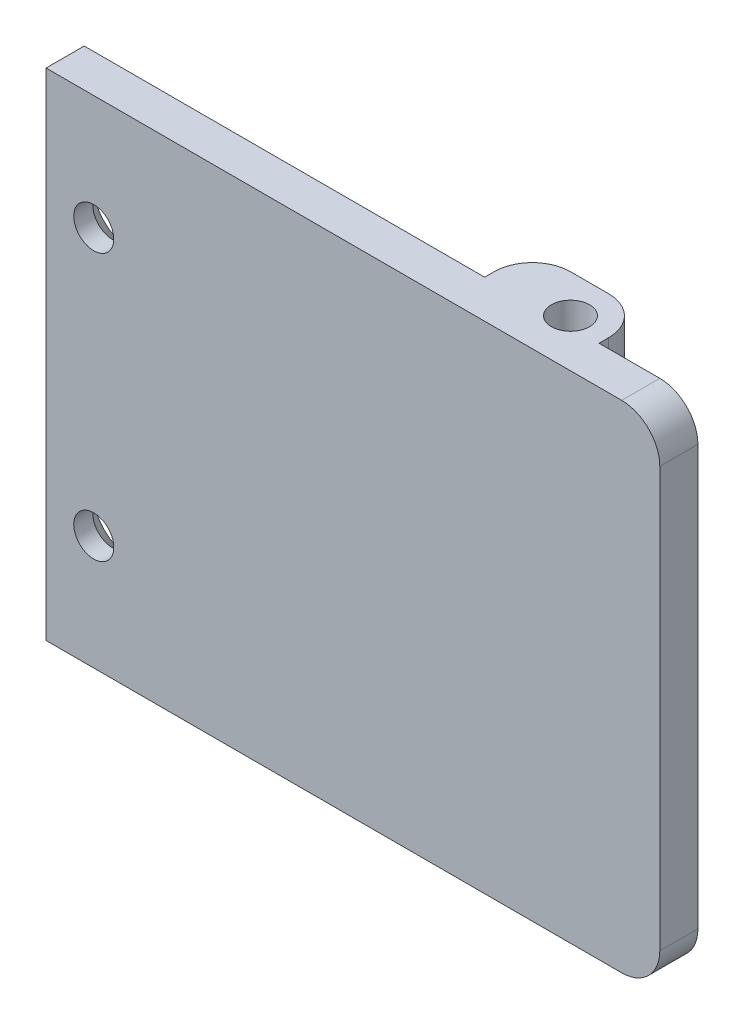
from build123d import *

# Parameters (mm, degrees)
SKETCH_2_W          = 32.183544672
SKETCH_2_H          = 26
EXTRUDE_1_DEPTH     = 2
FILLET_1_R          = 2
CUT_EXTRUDE_2_REACH = 38.671
SKETCH_4_R          = 1.05
CHAMFER_1_SIZE      = 1
SKETCH_5_W          = 6
SKETCH_5_H          = 2
EXTRUDE_2_DEPTH     = 2.5
FILLET_2_R          = 2
SKETCH_6_R          = 1
CUT_EXTRUDE_3_DEPTH = 4
CUT_EXTRUDE_3_DRAFT = -2
SKETCH_7_R          = 1
CUT_EXTRUDE_4_DEPTH = 4
CUT_EXTRUDE_4_DRAFT = -2


with BuildPart() as part:
    # 草图2 → 凸台-拉伸1 (new body)
    with BuildSketch(Plane.XY):
        with Locations((-0.901029093, -19.434236018)):
            Rectangle(SKETCH_2_W, SKETCH_2_H)
    extrude(amount=EXTRUDE_1_DEPTH)

    # 圆角1
    fillet_1_edges = [part.edges().sort_by_distance(p)[0] for p in [
        (15.190743243, -32.434236018, 1),
        (15.190743243, -6.434236018, 1),
    ]]
    fillet(fillet_1_edges, radius=FILLET_1_R)

    # 草图4 → 切除-拉伸2 (cut, up to next)
    with BuildSketch(Plane(origin=(0, 0, 0), x_dir=(-1, 0, 0), z_dir=(0, 0, -1)), mode=Mode.PRIVATE) as cut_extrude_2_sk1:
        with Locations((14.492801429, -12.434236018)):
            Circle(SKETCH_4_R)
    cut_extrude_2_tool1 = extrude(cut_extrude_2_sk1.sketch, amount=-CUT_EXTRUDE_2_REACH, mode=Mode.PRIVATE) & part.part
    # 草图4 → 切除-拉伸2 (cut, up to next)
    with BuildSketch(Plane(origin=(0, 0, 0), x_dir=(-1, 0, 0), z_dir=(0, 0, -1)), mode=Mode.PRIVATE) as cut_extrude_2_sk2:
        with Locations((14.492801429, -26.434236018)):
            Circle(SKETCH_4_R)
    cut_extrude_2_tool2 = extrude(cut_extrude_2_sk2.sketch, amount=-CUT_EXTRUDE_2_REACH, mode=Mode.PRIVATE) & part.part
    add(cut_extrude_2_tool1.solids().sort_by_distance((-14.492801, -12.434236, 0))[0], mode=Mode.SUBTRACT)
    add(cut_extrude_2_tool2.solids().sort_by_distance((-14.492801, -26.434236, 0))[0], mode=Mode.SUBTRACT)

    # 倒角1
    chamfer_1_edges = [part.edges().sort_by_distance(p)[0] for p in [
        (-13.442801429, -12.434236018, 0),
        (-13.442801429, -26.434236018, 0),
    ]]
    chamfer(chamfer_1_edges, length=CHAMFER_1_SIZE)

    # 草图5 → 凸台-拉伸2 (add)
    with BuildSketch(Plane(origin=(0, 0, 0), x_dir=(-1, 0, 0), z_dir=(0, 0, -1))):
        with Locations((-7.007198571, -7.434236018)):
            Rectangle(SKETCH_5_W, SKETCH_5_H)
        with Locations((-7.007198571, -31.434236018)):
            Rectangle(SKETCH_5_W, SKETCH_5_H)
    extrude(amount=EXTRUDE_2_DEPTH)

    # 圆角2
    fillet_2_edges = [part.edges().sort_by_distance(p)[0] for p in [
        (4.007198571, -7.434236018, -2.5),
        (10.007198571, -7.434236018, -2.5),
        (4.007198571, -31.434236018, -2.5),
        (10.007198571, -31.434236018, -2.5),
    ]]
    fillet(fillet_2_edges, radius=FILLET_2_R)


with BuildPart() as cut_extrude_3_tool:
    # 草图6 → 切除-拉伸3 (with draft: the straight prism first)
    with BuildSketch(Plane.XZ.offset(32.434236018)):
        with Locations((7.007198571, 0)):
            Circle(SKETCH_6_R)
    extrude(amount=-CUT_EXTRUDE_3_DEPTH)
    # 切除-拉伸3: the draft: its side faces are tilted about the plane it starts from
    cut_extrude_3_sides = [cut_extrude_3_tool.faces().sort_by_distance(p)[0] for p in [
        (6.007198571, -30.434236018, 0),
    ]]
    draft(cut_extrude_3_sides, Plane.XZ.offset(32.434236018), CUT_EXTRUDE_3_DRAFT)


with BuildPart() as part_1:
    add(part.part)

    # 切除-拉伸3: cut by cut_extrude_3_tool
    add(cut_extrude_3_tool.part, mode=Mode.SUBTRACT)


with BuildPart() as cut_extrude_4_tool:
    # 草图7 → 切除-拉伸4 (with draft: the straight prism first)
    with BuildSketch(Plane(origin=(0, -6.434236018, 0), x_dir=(1, 0, 0), z_dir=(0, 1, 0))):
        with Locations((8.007198571, 0.5)):
            Circle(SKETCH_7_R)
    extrude(amount=-CUT_EXTRUDE_4_DEPTH)
    # 切除-拉伸4: the draft: its side faces are tilted about the plane it starts from
    cut_extrude_4_sides = [cut_extrude_4_tool.faces().sort_by_distance(p)[0] for p in [
        (7.007198571, -8.434236018, -0.5),
    ]]
    draft(cut_extrude_4_sides, Plane(origin=(0, -6.434236018, 0), x_dir=(1, 0, 0), z_dir=(0, 1, 0)), CUT_EXTRUDE_4_DRAFT)


with BuildPart() as part_2:
    add(part_1.part)

    # 切除-拉伸4: cut by cut_extrude_4_tool
    add(cut_extrude_4_tool.part, mode=Mode.SUBTRACT)


solid = part_2.part
